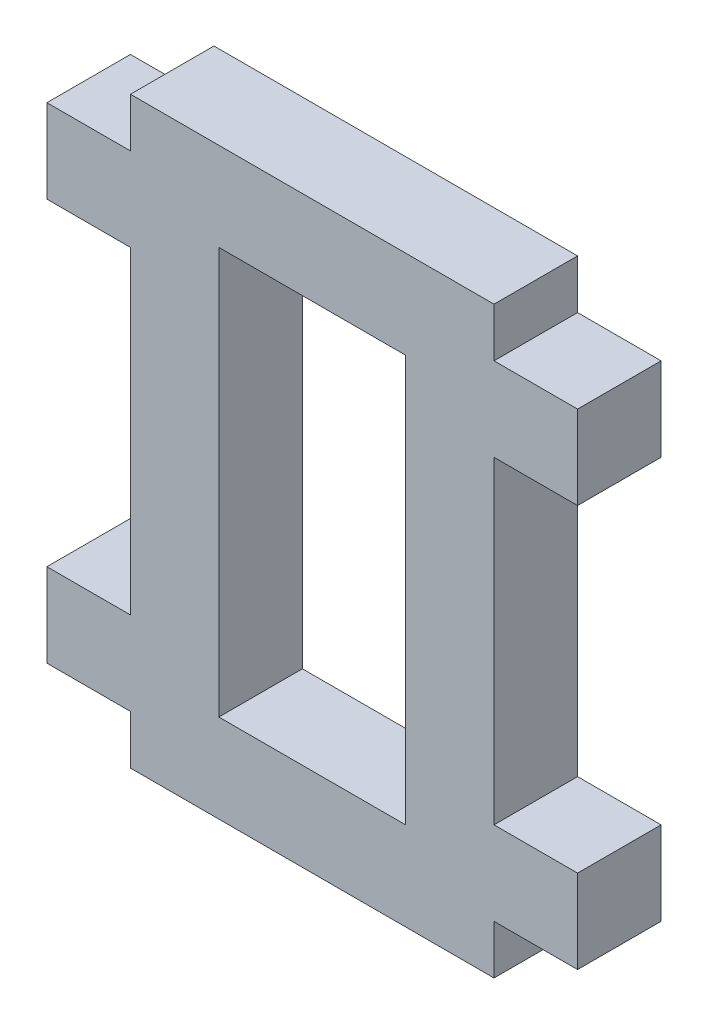
from build123d import *

# Parameters (mm, degrees)
BOSS_EXTRUDE1_DEPTH = 6
SKETCH2_W           = 13.4112
SKETCH2_H           = 29.21
CUT_EXTRUDE1_DEPTH  = 29.952166005


with BuildPart() as part:
    # Sketch1 → Boss-Extrude1 (new body)
    with BuildSketch(Plane.XY):
        Polygon((13.0556, 20.955), (-13.0556, 20.955), (-13.0556, 17.43), (-19.0556, 17.43), (-19.0556, 11.43), (-13.0556, 11.43), (-13.0556, -11.43), (-19.0556, -11.43), (-19.0556, -17.43), (-13.0556, -17.43), (-13.0556, -20.955), (13.0556, -20.955), (13.0556, -17.43), (19.0556, -17.43), (19.0556, -11.43), (13.0556, -11.43), (13.0556, 11.43), (19.0556, 11.43), (19.0556, 17.43), (13.0556, 17.43), align=None)
    extrude(amount=BOSS_EXTRUDE1_DEPTH)

    # Sketch2 → Cut-Extrude1 (cut, through all)
    with BuildSketch(Plane.XY.offset(6)):
        Rectangle(SKETCH2_W, SKETCH2_H)
    extrude(amount=-CUT_EXTRUDE1_DEPTH, mode=Mode.SUBTRACT)


solid = part.part
